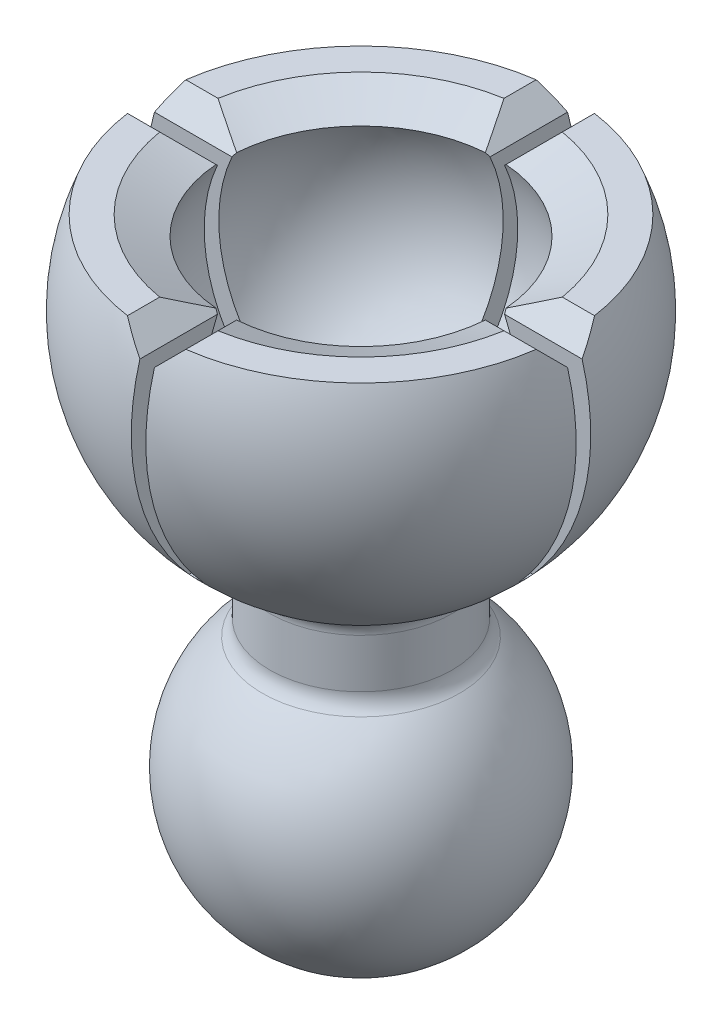
from build123d import *

# Parameters (mm, degrees)
CUT_EXTRUDE1_SOCKET_SLIT_DEPTH  = 18.588952107
CIRPATTERN1_PATTERN_SLITS_COUNT = 4
CHAMFER1_SIZE                   = 0.762
FILLET1_R                       = 0.762


with BuildPart() as part:
    # Sketch1 → Revolve1 - main body (revolve)
    with BuildSketch(Plane.XY):
        with BuildLine():
            Line((0, 0), (0, 13.751471687))
            ThreePointArc((0, 13.751471687), (-4.410161159, 16.183513693), (-4.70662, 21.211083874))
            Line((-4.70662, 21.211083874), (-6.08215434, 21.867194596))
            Line((-6.08215434, 21.867194596), (-7.191504241, 21.867194596))
            ThreePointArc((-7.191504241, 21.867194596), (-7.193470164, 16.069866844), (-3.175, 11.891241417))
            Line((-3.175, 11.891241417), (-3.175, 9.351241417))
            ThreePointArc((-3.175, 9.351241417), (-4.937771284, 3.538112772), (0, 0))
        make_face()
    revolve(axis=Axis((0, 0, 0), (0, -1, 0)))

    # Sketch2 → Cut-Extrude1 - socket slit (cut, through all)
    with BuildSketch(Plane(origin=(0, 13.751471687, 0), x_dir=(-1, 0, 0), z_dir=(0, -1, 0))):
        with BuildLine():
            Line((0, 0.254), (9.731504241, 0.254))
            ThreePointArc((9.731504241, 0.254), (9.985504241, 0), (9.731504241, -0.254))
            Line((9.731504241, -0.254), (0, -0.254))
            ThreePointArc((0, -0.254), (-0.254, 0), (0, 0.254))
        make_face()
    cut_extrude1_socket_slit = extrude(amount=-CUT_EXTRUDE1_SOCKET_SLIT_DEPTH, mode=Mode.SUBTRACT)

    # CirPattern1 - pattern slits: Cut-Extrude1 - socket slit ×4 about axis
    cirpattern1_pattern_slits_axis = Axis((0, 0, 0), (0, 1, 0))
    for i in range(1, CIRPATTERN1_PATTERN_SLITS_COUNT):
        add(cut_extrude1_socket_slit.rotate(cirpattern1_pattern_slits_axis, i * 360 / CIRPATTERN1_PATTERN_SLITS_COUNT), mode=Mode.SUBTRACT)

    # Chamfer1
    # the kernel refuses this chamfer: 0.762 mm, written as the material it takes off along each edge
    with BuildSketch(Plane(origin=(9.146639708, 21.867194596, 0.254), x_dir=(0, 0.02749587661058728, 0.9996219169112966), z_dir=(-1, 0, 0)), Plane(origin=(0.254, 21.867194596, -9.146639708), x_dir=(0.9996219169112966, 0.02749587661058728, 0), z_dir=(0, 0, 1)), Plane(origin=(-0.254, 21.867194596, 9.146639708), x_dir=(-0.9996219169112966, 0.027495876610587285, 0), z_dir=(0, 0, -1))) as chamfer1_piece_1:
        Polygon((CHAMFER1_SIZE * 0.999621916911, -CHAMFER1_SIZE * 0.0274958766106), (-CHAMFER1_SIZE * 0.0274958766106, -CHAMFER1_SIZE * 0.999621916911), (0, 0), align=None)
    extrude(amount=5.029413832, mode=Mode.SUBTRACT)
    with BuildSketch(Plane(origin=(4.117225876, 21.867194596, -0.254), x_dir=(0, -0.9996219169112968, 0.027495876610586327), z_dir=(1, 0, 0)), Plane(origin=(-0.254, 21.867194596, -4.117225876), x_dir=(0.027495876610586327, -0.9996219169112968, 0), z_dir=(0, 0, -1)), Plane(origin=(0.254, 21.867194596, 4.117225876), x_dir=(-0.027495876610586327, -0.9996219169112968, 0), z_dir=(0, 0, 1)), Plane(origin=(-9.146639708, 21.867194596, -0.254), x_dir=(0, -0.9996219169112968, 0.027495876610586327), z_dir=(1, 0, 0)), Plane(origin=(-4.117225876, 21.867194596, 0.254), x_dir=(0, -0.9996219169112968, -0.027495876610586327), z_dir=(-1, 0, 0))) as chamfer1_piece_2:
        Polygon((CHAMFER1_SIZE * 0.999621916911, CHAMFER1_SIZE * 0.0274958766106), (-CHAMFER1_SIZE * 0.0274958766106, CHAMFER1_SIZE * 0.999621916911), (0, 0), align=None)
    extrude(amount=5.029413832, mode=Mode.SUBTRACT)

    # Fillet1
    fillet1_edges = [part.edges().sort_by_distance(p)[0] for p in [
        (3.175, 11.891241417, 0),
        (3.175, 9.351241417, 0),
    ]]
    fillet(fillet1_edges, radius=FILLET1_R)


solid = part.part
